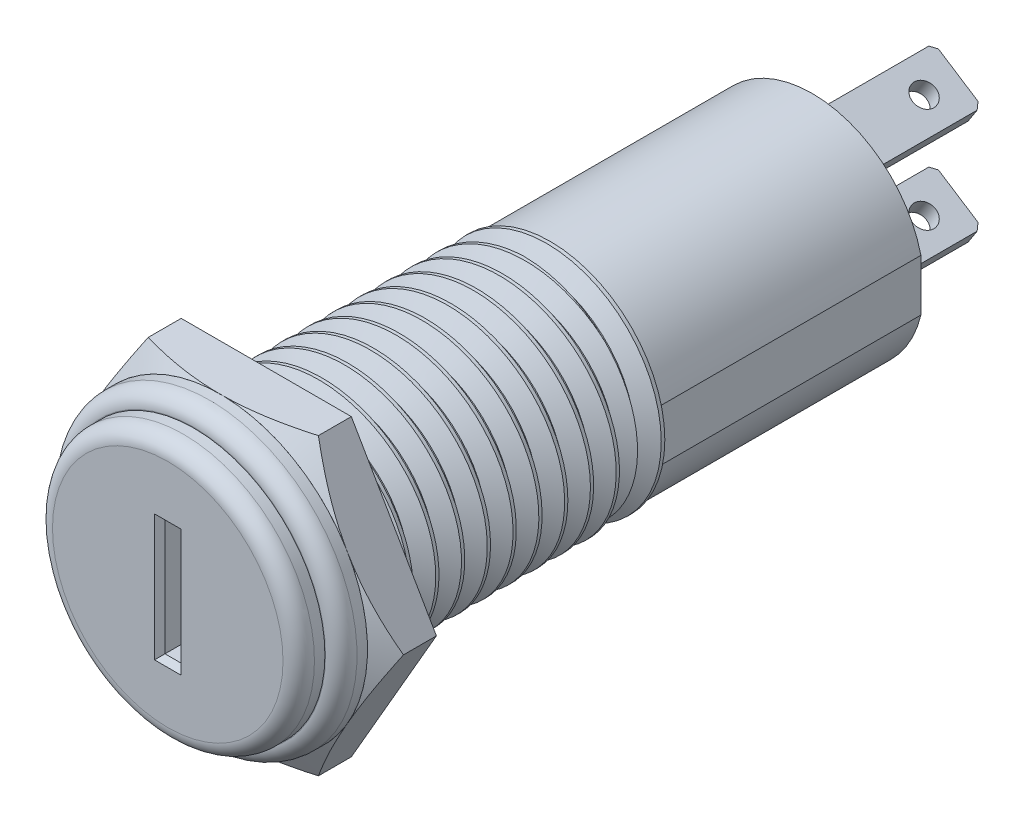
from build123d import *

# Parameters (mm, degrees)
SKETCH2_R             = 6.35
BOSS_EXTRUDE1_DEPTH   = 1.27
SKETCH3_R             = 7.14375
BOSS_EXTRUDE2_DEPTH   = 1.27
BOSS_EXTRUDE3_DEPTH   = 2.2352
SKETCH5_OUTSIDE_W     = 27.366
SKETCH5_OUTSIDE_H     = 25.156
SKETCH5_OUTSIDE_R     = 7.14375
CUT_EXTRUDE1_DEPTH    = 1.27
CUT_EXTRUDE1_DRAFT    = -60
SKETCH6_R             = 5.55625
BOSS_EXTRUDE4_DEPTH   = 26.4668
CUT_SWEEP1_PITCH      = 1.25
CUT_SWEEP1_FROM       = 0
BOSS_EXTRUDE5_DEPTH   = 6.858
SKETCH14_R            = 0.563760802
CUT_EXTRUDE2_DEPTH    = 0.8128
CHAMFER1_SIZE         = 0.254
LPATTERN2_COUNT       = 2
LPATTERN2_PITCH       = 5.08
SKETCH15_W            = 0.775591068
SKETCH15_H            = 5.623035242
CUT_EXTRUDE3_DEPTH    = 4.7752
CHAMFER2_SIZE         = 0.254
BODY_MOVE_COPY1_ANGLE = 180
FILLET1_R             = 0.762
FILLET2_R             = 0.762
SKETCH16_OUTSIDE_W    = 27.28
SKETCH16_OUTSIDE_H    = 25.07
CUT_EXTRUDE4_DEPTH    = 12.7
SKETCH17_OUTSIDE_W    = 27.28
SKETCH17_OUTSIDE_H    = 25.07
SKETCH17_OUTSIDE_R    = 5.417378827
CUT_EXTRUDE5_DEPTH    = 12.7


with BuildPart() as part:
    # Sketch2 → Boss-Extrude1 (new body)
    with BuildSketch(Plane.XY.offset(-19.05)):
        Circle(SKETCH2_R)
    extrude(amount=BOSS_EXTRUDE1_DEPTH)


with BuildPart() as body_2:
    # Sketch3 → Boss-Extrude2 (new body)
    with BuildSketch(Plane.XY.offset(-17.78)):
        Circle(SKETCH3_R)
    extrude(amount=BOSS_EXTRUDE2_DEPTH)


with BuildPart() as body_3:
    # Sketch4 → Boss-Extrude3 (new body)
    with BuildSketch(Plane.XY.offset(-16.51)):
        Polygon((4.124445986, -7.14375), (8.248891971, 0), (4.124445986, 7.14375), (-4.124445986, 7.14375), (-8.248891971, 0), (-4.124445986, -7.14375), align=None)
    extrude(amount=BOSS_EXTRUDE3_DEPTH)


with BuildPart() as cut_extrude1_tool:
    # Sketch5 outside → Cut-Extrude1 (with draft: the straight prism first)
    with BuildSketch(Plane(origin=(0, 0, -16.51), x_dir=(-1, 0, 0), z_dir=(0, 0, -1))):
        Rectangle(SKETCH5_OUTSIDE_W, SKETCH5_OUTSIDE_H)
        with Locations(Location((0, 0, 0), (0, 0, 180))):
            Circle(SKETCH5_OUTSIDE_R, mode=Mode.SUBTRACT)
    extrude(amount=-CUT_EXTRUDE1_DEPTH)
    # Cut-Extrude1: the draft: its side faces are tilted about the plane it starts from
    cut_extrude1_sides = [cut_extrude1_tool.faces().sort_by_distance(p)[0] for p in [
        (0, -12.578, -15.875),
        (-13.683, 0, -15.875),
        (0, 12.578, -15.875),
        (13.683, 0, -15.875),
        (-7.14375, 0, -15.875),
    ]]
    draft(cut_extrude1_sides, Plane(origin=(0, 0, -16.51), x_dir=(-1, 0, 0), z_dir=(0, 0, -1)), CUT_EXTRUDE1_DRAFT)


with BuildPart() as body_3_1:
    add(body_3.part)

    # Cut-Extrude1: cut by cut_extrude1_tool
    add(cut_extrude1_tool.part, mode=Mode.SUBTRACT)


with BuildPart() as body_4:
    # Sketch6 → Boss-Extrude4 (new body)
    with BuildSketch(Plane.XY.offset(-14.2748)):
        Circle(SKETCH6_R)
    extrude(amount=BOSS_EXTRUDE4_DEPTH)

    # Cut-Sweep1: arcs per turn and ends read off the stored shape
    # Cut-Sweep1: the profile of Sketch8 screwed along a right-hand helix through 11 turns, 8 arcs to a turn; built about Z, then put on its axis
    cut_sweep1_z = Axis((0, 0, 0), (0, 0, 1))
    cut_sweep1_corners = [(5.691566469, 0, -0.078125), (5.55625, 0, -1.25), (4.744351184, 0, -0.78125), (4.744351184, 0, -0.625)]
    with BuildLine(mode=Mode.PRIVATE) as cut_sweep1_profile:
        Line(cut_sweep1_corners[0], cut_sweep1_corners[1])
        Line(cut_sweep1_corners[1], cut_sweep1_corners[2])
        Line(cut_sweep1_corners[2], cut_sweep1_corners[3])
        Line(cut_sweep1_corners[3], cut_sweep1_corners[0])
    cut_sweep1_cap = Face(cut_sweep1_profile.wire())
    cut_sweep1_turn_angles = [0, 22.5, 45, 67.5, 90, 112.5, 135, 157.5, 180, 202.5, 225, 247.5, 270, 292.5, 315, 337.5, 360]
    cut_sweep1_turn_weights = [1, 0.9238795325112867, 1, 0.9238795325112867, 1, 0.9238795325112867, 1, 0.9238795325112867, 1, 0.9238795325112867, 1, 0.9238795325112867, 1, 0.9238795325112867, 1, 0.9238795325112867, 1]
    cut_sweep1_turn_rails = [Edge.make_bspline([Vector(p[0], p[1], 0).rotate(cut_sweep1_z, cut_sweep1_turn_angles[k]) / cut_sweep1_turn_weights[k] + Vector(0, 0, p[2] + CUT_SWEEP1_PITCH * cut_sweep1_turn_angles[k] / 360) for k in range(17)], [0, 0, 0, 1, 1, 2, 2, 3, 3, 4, 4, 5, 5, 6, 6, 7, 7, 8, 8, 8], 2, cut_sweep1_turn_weights) for p in cut_sweep1_corners]
    cut_sweep1_turn_sides = [Face.make_surface_from_curves(cut_sweep1_turn_rails[p[0]], cut_sweep1_turn_rails[p[1]]) for p in [(0, 1), (1, 2), (2, 3), (3, 0)]]
    cut_sweep1 = Plane(origin=(0, 0, -14.2748), x_dir=(0, 1, 0), z_dir=(0, 0, 1)) * split(Solid(Shell([*[p.moved(Location((0, 0, CUT_SWEEP1_PITCH * i))) for i in range(11) for p in cut_sweep1_turn_sides], cut_sweep1_cap, cut_sweep1_cap.rotate(cut_sweep1_z, 3960).moved(Location((0, 0, CUT_SWEEP1_PITCH * 3960 / 360)))])), bisect_by=Plane.XY.offset(CUT_SWEEP1_FROM), keep=Keep.TOP, mode=Mode.PRIVATE)
    add(cut_sweep1, mode=Mode.SUBTRACT)

    # Cut-Sweep2: sweep along a path in Sketch11
    with BuildLine(Plane(origin=(0, 5.55625, -1.7748), x_dir=(-1, 0, 0), z_dir=(0, 0, -1))) as cut_sweep2_path:
        CenterArc((0, -5.55625), 5.55625, 0, 360)
    # Sketch12 → Cut-Sweep2 (sweep, cut)
    with BuildSketch(Plane(origin=(0, 0, 0), x_dir=(0, 0, -1), z_dir=(1, 0, 0))):
        Polygon((1.7748, 5.55625), (1.30605, 4.744351184), (1.1498, 4.744351184), (0.68105, 5.55625), align=None)
    sweep(path=cut_sweep2_path.line, mode=Mode.SUBTRACT)


with BuildPart() as body_5:
    # Sketch13 → Boss-Extrude5 (new body)
    with BuildSketch(Plane.XY.offset(12.192)):
        Polygon((0.952658529, 3.625355881), (-1.393867941, 2.108698528), (-0.952658529, 1.426072646), (1.393867941, 2.942729999), align=None)
    extrude(amount=BOSS_EXTRUDE5_DEPTH)

    # Sketch14 → Cut-Extrude2 (cut)
    with BuildSketch(Plane(origin=(-1.372052748, 2.122798592, 0), x_dir=(0.8398448353890338, 0.5428265399465716, 0), z_dir=(-0.5428265399465716, 0.8398448353890338, 0))):
        with Locations(Location((1.371024734, -17.396274482, 0), (0, 0, 180))):
            Circle(SKETCH14_R)
    extrude(amount=-CUT_EXTRUDE2_DEPTH, mode=Mode.SUBTRACT)

    # Chamfer1
    chamfer1_edges = [body_5.edges().sort_by_distance(p)[0] for p in [
        (-1.173263235, 1.767385587, 19.05),
        (1.173263235, 3.28404294, 19.05),
    ]]
    chamfer(chamfer1_edges, length=CHAMFER1_SIZE)


with BuildPart() as lpattern2_1:
    # LPattern2: pattern copy
    add(body_5.part.moved(Location(Vector(0, -1, 0) * (1 * LPATTERN2_PITCH))))


with BuildPart() as cut_extrude3_tool:
    # Sketch15 → Cut-Extrude3 (new body)
    with BuildSketch(Plane(origin=(0, 0, -19.05), x_dir=(-1, 0, 0), z_dir=(0, 0, -1))):
        Rectangle(SKETCH15_W, SKETCH15_H)
    extrude(amount=-CUT_EXTRUDE3_DEPTH)


with BuildPart() as part_1:
    add(part.part)

    # Cut-Extrude3: cut by cut_extrude3_tool
    add(cut_extrude3_tool.part, mode=Mode.SUBTRACT)

    # Chamfer2
    chamfer2_edges = [part_1.edges().sort_by_distance(p)[0] for p in [
        (-0.387795534, 0, -19.05),
        (0, 2.811517621, -19.05),
        (0.387795534, 0, -19.05),
        (0, -2.811517621, -19.05),
    ]]
    chamfer(chamfer2_edges, length=CHAMFER2_SIZE)


with BuildPart() as body_2_1:
    add(body_2.part)

    # Cut-Extrude3: cut by cut_extrude3_tool
    add(cut_extrude3_tool.part, mode=Mode.SUBTRACT)


with BuildPart() as body_3_2:
    add(body_3_1.part)

    # Cut-Extrude3: cut by cut_extrude3_tool
    add(cut_extrude3_tool.part, mode=Mode.SUBTRACT)


with BuildPart() as lpattern2_1_1:
    # Body-Move/Copy1: moved
    add(lpattern2_1.part.moved(Location((0, 0, 0))).rotate(Axis((-0.020417336, 0, -3.504422818), (0, 1, 0)), BODY_MOVE_COPY1_ANGLE))


with BuildPart() as body_5_1:
    # Body-Move/Copy1: moved
    add(body_5.part.moved(Location((0, 0, 0))).rotate(Axis((-0.020417336, 0, -3.504422818), (0, 1, 0)), BODY_MOVE_COPY1_ANGLE))


with BuildPart() as body_4_1:
    # Body-Move/Copy1: moved
    add(body_4.part.moved(Location((0, 0, 0))).rotate(Axis((-0.020417336, 0, -3.504422818), (0, 1, 0)), BODY_MOVE_COPY1_ANGLE))

    # Sketch16 outside → Cut-Extrude4 (cut)
    with BuildSketch(Plane(origin=(0, 0, -19.200845635), x_dir=(-1, 0, 0), z_dir=(0, 0, -1))):
        with Locations((0.041, 0)):
            Rectangle(SKETCH16_OUTSIDE_W, SKETCH16_OUTSIDE_H)
        with BuildLine():
            Line((-5.229665328, 1.758904151), (-5.229665328, -1.758904151))
            ThreePointArc((-5.229665328, -1.758904151), (0.040834672, -5.55625), (5.311334672, -1.758904151))
            Line((5.311334672, -1.758904151), (5.311334672, 1.758904151))
            ThreePointArc((5.311334672, 1.758904151), (0.040834672, 5.55625), (-5.229665328, 1.758904151))
        make_face(mode=Mode.SUBTRACT)
    extrude(amount=-CUT_EXTRUDE4_DEPTH, mode=Mode.SUBTRACT)

    # Sketch17 outside → Cut-Extrude5 (cut)
    with BuildSketch(Plane(origin=(0, 0, -19.200845635), x_dir=(-1, 0, 0), z_dir=(0, 0, -1))):
        with Locations((0.041, 0)):
            Rectangle(SKETCH17_OUTSIDE_W, SKETCH17_OUTSIDE_H)
        with Locations((0.040834672, 0)):
            Circle(SKETCH17_OUTSIDE_R, mode=Mode.SUBTRACT)
    extrude(amount=-CUT_EXTRUDE5_DEPTH, mode=Mode.SUBTRACT)


with BuildPart() as body_2_2:
    # Body-Move/Copy1: moved
    add(body_2_1.part.moved(Location((0, 0, 0))).rotate(Axis((-0.020417336, 0, -3.504422818), (0, 1, 0)), BODY_MOVE_COPY1_ANGLE))

    # Fillet2
    fillet2_edges = [body_2_2.edges().sort_by_distance(p)[0] for p in [
        (7.102915328, 0, 10.771154365),
    ]]
    fillet(fillet2_edges, radius=FILLET2_R)


with BuildPart() as body_3_3:
    # Body-Move/Copy1: moved
    add(body_3_2.part.moved(Location((0, 0, 0))).rotate(Axis((-0.020417336, 0, -3.504422818), (0, 1, 0)), BODY_MOVE_COPY1_ANGLE))


with BuildPart() as part_2:
    # Body-Move/Copy1: moved
    add(part_1.part.moved(Location((0, 0, 0))).rotate(Axis((-0.020417336, 0, -3.504422818), (0, 1, 0)), BODY_MOVE_COPY1_ANGLE))

    # Fillet1
    fillet1_edges = [part_2.edges().sort_by_distance(p)[0] for p in [
        (6.309165328, 0, 12.041154365),
    ]]
    fillet(fillet1_edges, radius=FILLET1_R)


solid = Compound([lpattern2_1_1.part, body_5_1.part, body_4_1.part, body_2_2.part, body_3_3.part, part_2.part])
